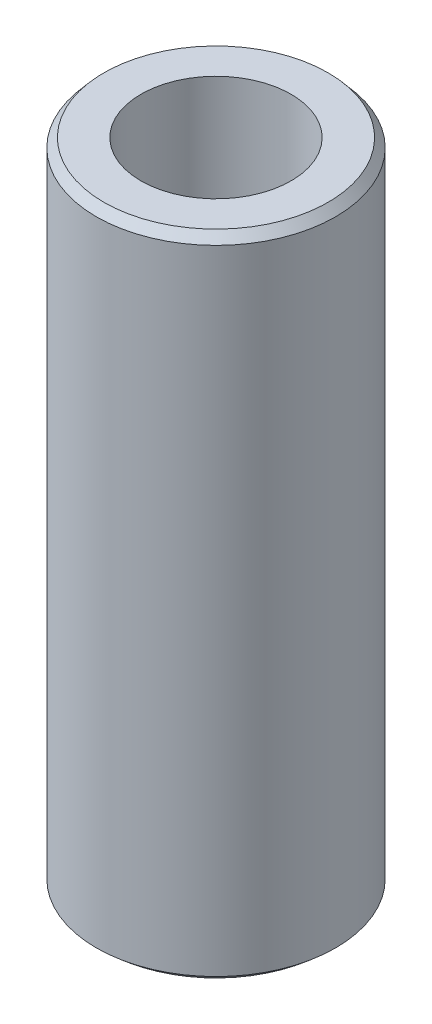
from build123d import *
from OCP.BRepFilletAPI import BRepFilletAPI_MakeChamfer

# Parameters (mm, degrees)
SKETCH1_R           = 37.5
BOSS_EXTRUDE1_DEPTH = 203.572110182
SKETCH2_R           = 23.536055521
CUT_EXTRUDE1_DEPTH  = 211.36659441
CHAMFER1_SIZE       = 2.761956269
CHAMFER1_SIZE2      = 2.347163133


with BuildPart() as part:
    # Sketch1 → Boss-Extrude1 (new body)
    with BuildSketch(Plane(origin=(0, 0, 0), x_dir=(1, 0, 0), z_dir=(0, 1, 0))):
        Circle(SKETCH1_R)
    extrude(amount=BOSS_EXTRUDE1_DEPTH)

    # Sketch2 → Cut-Extrude1 (cut, through all)
    with BuildSketch(Plane(origin=(0, 0, 0), x_dir=(1, 0, 0), z_dir=(0, 1, 0))):
        Circle(SKETCH2_R)
    extrude(amount=CUT_EXTRUDE1_DEPTH, mode=Mode.SUBTRACT)

    # Chamfer1: one chamfer whose edges measure the first distance from different faces: ONE call of the kernel's chamfer builder (chamfer() names one face for all edges)
    chamfer1_edges_1 = [part.edges().sort_by_distance(p)[0] for p in [
        (-37.5, 203.572110182, 0),
    ]]
    chamfer1_side_1 = [part.faces().sort_by_distance(p)[0] for p in [
        (-37.5, 101.786055091, 0),
    ]]
    chamfer1_edges_2 = [part.edges().sort_by_distance(p)[0] for p in [
        (-37.5, 0, 0),
    ]]
    chamfer1_side_2 = [part.faces().sort_by_distance(p)[0] for p in [
        (-36.439339828, 0, 0),
    ]]
    chamfer1 = BRepFilletAPI_MakeChamfer(part.part.solid().wrapped)
    for e in chamfer1_edges_1:
        chamfer1.Add(CHAMFER1_SIZE, CHAMFER1_SIZE2, e.wrapped, chamfer1_side_1[0].wrapped)  # the first distance lies on this face
    for e in chamfer1_edges_2:
        chamfer1.Add(CHAMFER1_SIZE, CHAMFER1_SIZE2, e.wrapped, chamfer1_side_2[0].wrapped)  # the first distance lies on this face
    add(Compound.cast(chamfer1.Shape()), mode=Mode.REPLACE)


solid = part.part
